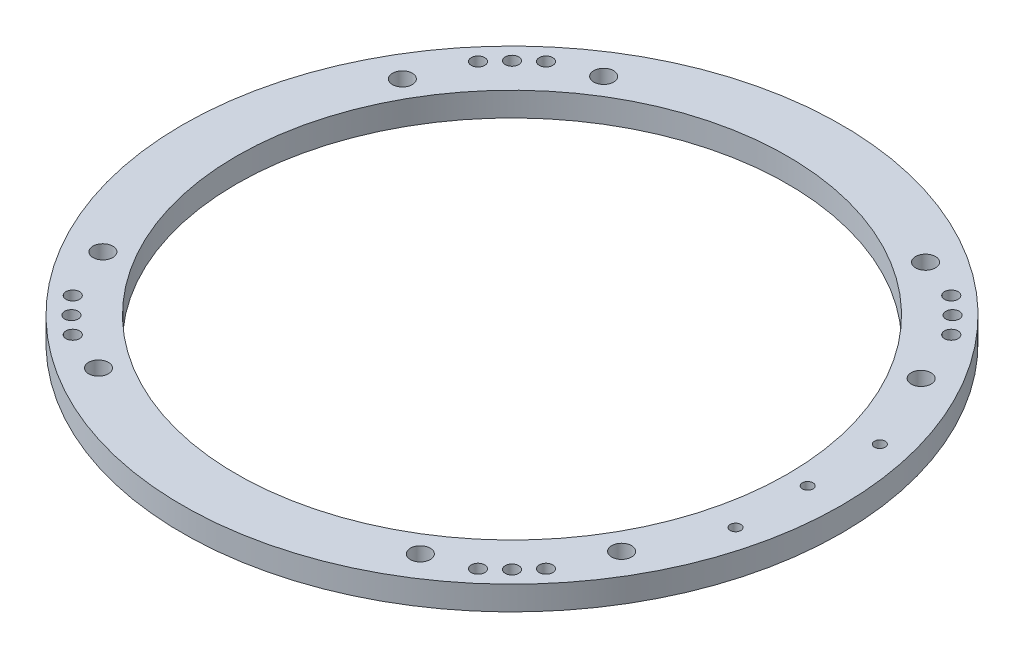
from build123d import *

# Parameters (mm, degrees)
F_9_32_0_28125_DIAMETER_HOLE1_D = 7.14375
CIRPATTERN1_COUNT               = 4
F_10_CLEARANCE_HOLE1_D          = 5.6134
Z_0_413_DIAMETER_HOLE1_D        = 10.4902


with BuildPart() as part:
    # Sketch1 → Revolve1 (revolve)
    with BuildSketch(Plane.XY):
        Polygon((145.526233777, 1064.895), (145.526233777, 1052.195), (152.4, 1052.195), (174.101233777, 1052.195), (174.101233777, 1064.895), align=None)
    revolve(axis=Axis((0, 1125.81516809, 0), (0, -1, 0)))

    # 9/32 (0.28125) Diameter Hole1 (through all)
    with Locations(Plane(origin=(0, 1052.195, 0), x_dir=(-1, 0, 0), z_dir=(0, -1, 0))):
        with Locations((107.045703742, 125.006215984), (125.006215984, 107.045703742), (116.372970926, 116.372970926)):
            f_9_32_0_28125_diameter_hole1 = Hole(F_9_32_0_28125_DIAMETER_HOLE1_D / 2)

    # CirPattern1: 9/32 (0.28125) Diameter Hole1 ×4 about axis
    cirpattern1_axis = Axis((0, 1125.81516809, 0), (0, 1, 0))
    for i in range(1, CIRPATTERN1_COUNT):
        add(f_9_32_0_28125_diameter_hole1.rotate(cirpattern1_axis, i * 360 / CIRPATTERN1_COUNT), mode=Mode.SUBTRACT)

    # #10 Clearance Hole1 (through all)
    with Locations(Plane(origin=(0, 1064.895, 0), x_dir=(1, 0, 0), z_dir=(0, 1, 0))):
        with Locations((156.21, 38.1), (156.21, 0), (156.21, -38.1)):
            Hole(F_10_CLEARANCE_HOLE1_D / 2)

    # Z (0.413) Diameter Hole1 (through all)
    with Locations(Plane(origin=(0, 1064.895, 0), x_dir=(1, 0, 0), z_dir=(0, 1, 0))):
        with Locations((-137.027937996, -79.113116888), (137.027937996, -79.113116888), (137.027937996, 79.113116888), (-137.027937996, 79.113116888), (-85.014893438, 133.44665207), (85.014893438, 133.44665207), (85.014893438, -133.44665207), (-85.014893438, -133.44665207)):
            Hole(Z_0_413_DIAMETER_HOLE1_D / 2)


solid = part.part
